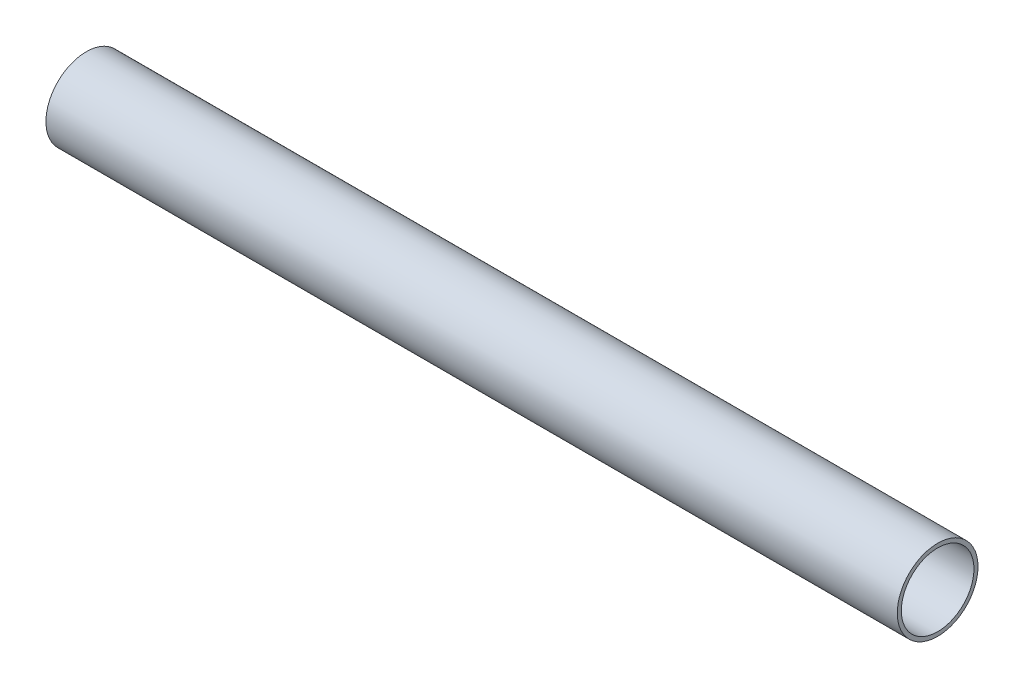
from build123d import *

# Parameters (mm, degrees)
SKETCH1_R           = 15.875
SKETCH1_R_2         = 14.2875
EXTRUDE_THIN1_DEPTH = 167.4495


with BuildPart() as part:
    # Sketch1 → Extrude-Thin1 (new, symmetric)
    with BuildSketch(Plane(origin=(0, 0, 0), x_dir=(0, 0, -1), z_dir=(1, 0, 0))):
        Circle(SKETCH1_R)
        Circle(SKETCH1_R_2, mode=Mode.SUBTRACT)
    extrude(amount=EXTRUDE_THIN1_DEPTH, both=True)


solid = part.part
